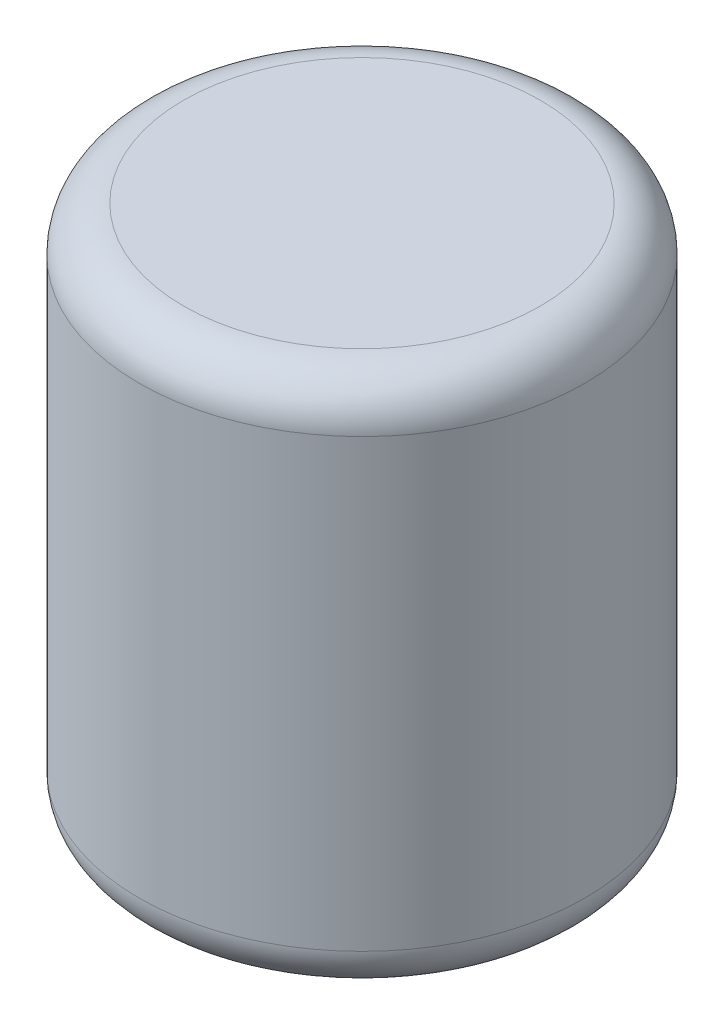
from build123d import *

# Parameters (mm, degrees)
SKETCH2_R           = 63.5
BOSS_EXTRUDE1_DEPTH = 152.4
FILLET1_R           = 12.7


with BuildPart() as part:
    # Sketch2 → Boss-Extrude1 (new body)
    with BuildSketch(Plane(origin=(0, 0, 0), x_dir=(1, 0, 0), z_dir=(0, 1, 0))):
        Circle(SKETCH2_R)
    extrude(amount=BOSS_EXTRUDE1_DEPTH)

    # Fillet1
    fillet1_edges = [part.edges().sort_by_distance(p)[0] for p in [
        (-63.5, 0, 0),
        (-63.5, 152.4, 0),
    ]]
    fillet(fillet1_edges, radius=FILLET1_R)


solid = part.part
